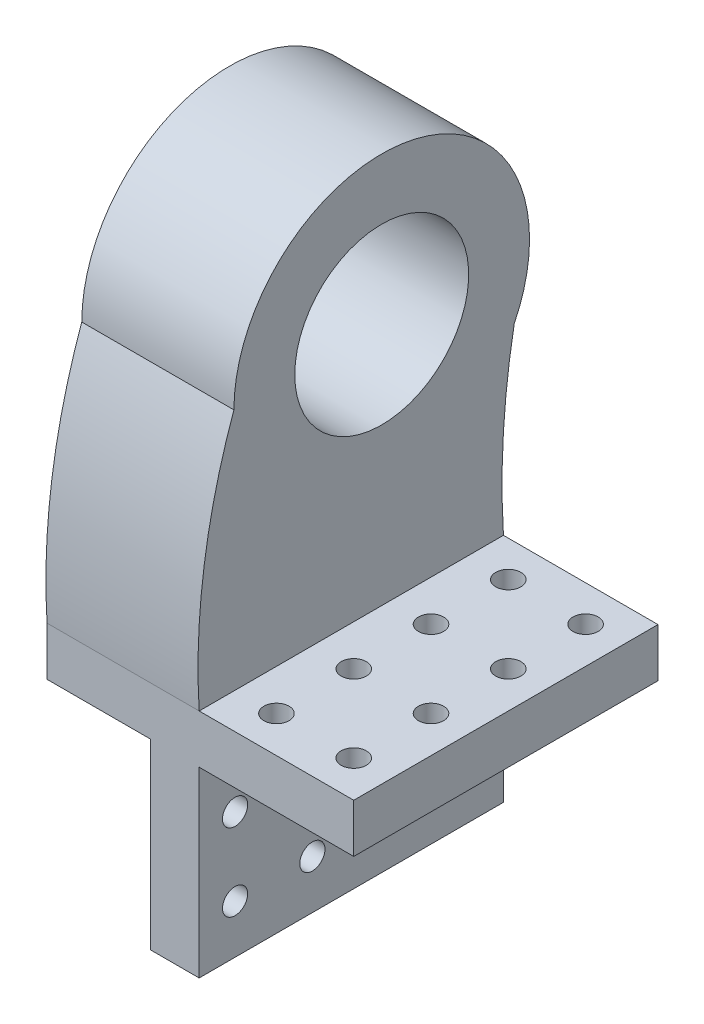
from build123d import *

# Parameters (mm, degrees)
CROQUIS1_W              = 50.4
CROQUIS1_H              = 50
SALIENTE_EXTRUIR1_DEPTH = 8
CROQUIS2_R              = 14.29
SALIENTE_EXTRUIR2_DEPTH = 25
CROQUIS3_W              = 8
CROQUIS3_H              = 50
SALIENTE_EXTRUIR3_DEPTH = 30
CROQUIS4_R              = 2.07
CORTAR_EXTRUIR1_DEPTH   = 30
CROQUIS5_R              = 2.07
CORTAR_EXTRUIR2_DEPTH   = 85.848737174


with BuildPart() as part:
    # Croquis1 → Saliente-Extruir1 (new body)
    with BuildSketch(Plane(origin=(0, 0, 0), x_dir=(1, 0, 0), z_dir=(0, 1, 0))):
        Rectangle(CROQUIS1_W, CROQUIS1_H)
    extrude(amount=SALIENTE_EXTRUIR1_DEPTH)

    # Croquis2 → Saliente-Extruir2 (add)
    with BuildSketch(Plane.ZY.offset(25.2)):
        with BuildLine():
            Line((-25, 8), (25, 8))
            ThreePointArc((25, 8), (24.186320964, 28.291398568), (19.29, 48))
            ThreePointArc((19.29, 48), (-10.519721366, 71.654529715), (-26.781368962, 37.249369036))
            ThreePointArc((-26.781368962, 37.249369036), (-24.994508191, 22.679264178), (-25, 8))
        make_face()
        with Locations((-5, 48)):
            Circle(CROQUIS2_R, mode=Mode.SUBTRACT)
    extrude(amount=-SALIENTE_EXTRUIR2_DEPTH)

    # Croquis3 → Saliente-Extruir3 (add)
    with BuildSketch(Plane.XZ):
        with Locations((-4.2, 0)):
            Rectangle(CROQUIS3_W, CROQUIS3_H)
    extrude(amount=SALIENTE_EXTRUIR3_DEPTH)

    # Croquis4 → Cortar-Extruir1 (cut)
    with BuildSketch(Plane(origin=(0, 8, 0), x_dir=(1, 0, 0), z_dir=(0, 1, 0))):
        with Locations((19.2, -19)):
            Circle(CROQUIS4_R)
        with Locations((19.2, -6.3)):
            Circle(CROQUIS4_R)
        with Locations((19.2, 6.4)):
            Circle(CROQUIS4_R)
        with Locations((19.2, 19.1)):
            Circle(CROQUIS4_R)
        with Locations((6.5, 19.1)):
            Circle(CROQUIS4_R)
        with Locations((6.5, 6.4)):
            Circle(CROQUIS4_R)
        with Locations((6.5, -6.3)):
            Circle(CROQUIS4_R)
        with Locations((6.5, -19)):
            Circle(CROQUIS4_R)
    extrude(amount=-CORTAR_EXTRUIR1_DEPTH, mode=Mode.SUBTRACT)

    # Croquis5 → Cortar-Extruir2 (cut, through all)
    with BuildSketch(Plane.ZY.offset(8.2)):
        with Locations((-19, -22)):
            Circle(CROQUIS5_R)
        with Locations((-6.3, -22)):
            Circle(CROQUIS5_R)
        with Locations((6.4, -22)):
            Circle(CROQUIS5_R)
        with Locations((19.1, -22)):
            Circle(CROQUIS5_R)
        with Locations((-19, -9.3)):
            Circle(CROQUIS5_R)
        with Locations((-6.3, -9.3)):
            Circle(CROQUIS5_R)
        with Locations((6.4, -9.3)):
            Circle(CROQUIS5_R)
        with Locations((19.1, -9.3)):
            Circle(CROQUIS5_R)
    extrude(amount=-CORTAR_EXTRUIR2_DEPTH, mode=Mode.SUBTRACT)


solid = part.part
